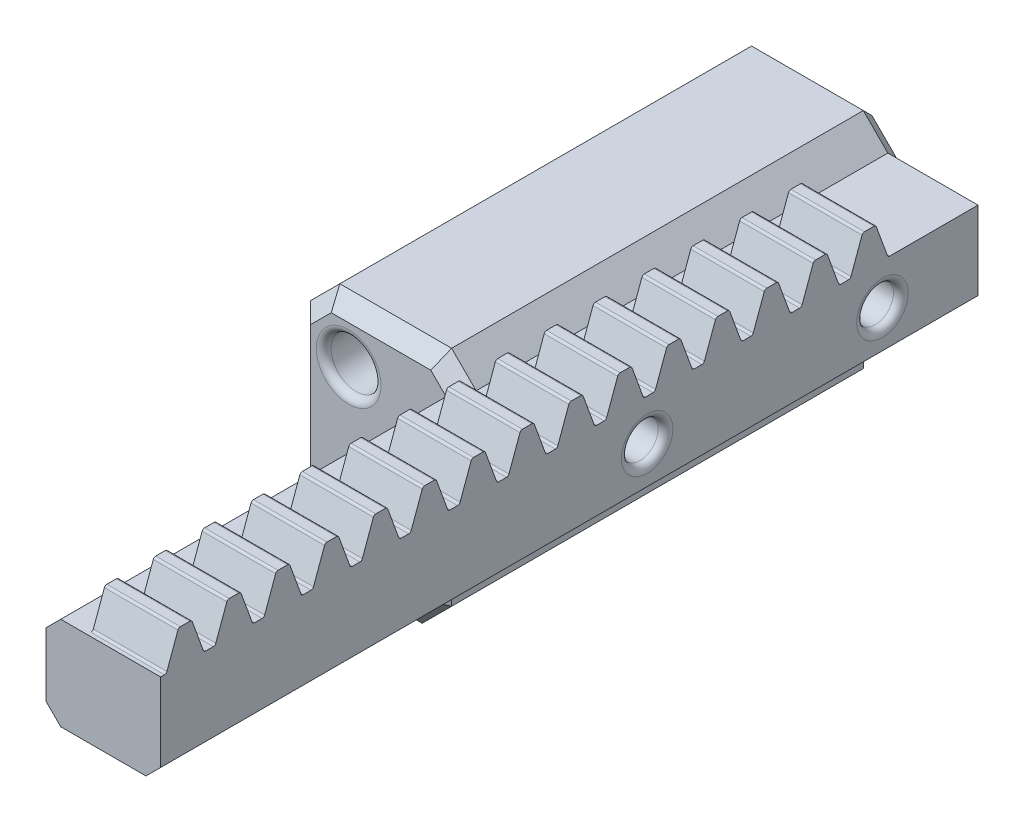
from build123d import *

# Parameters (mm, degrees)
ESBO_O2_W                     = 9.6
ESBO_O2_H                     = 17.2
ESBO_O2_R                     = 1.7
RESSALTO_EXTRUS_O2_DEPTH      = 30
CHANFRO1_SIZE                 = 2
RESSALTO_EXTRUS_O3_DEPTH      = 1
RESSALTO_EXTRUS_O3_DEPTH_BACK = 4
ESBO_O6_W                     = 30
ESBO_O6_H                     = 6.331
RESSALTO_EXTRUS_O5_DEPTH      = 2.8
CHANFRO3_SIZE                 = 1.67
FILETE1_R                     = 0.5
ESBO_O10_W                    = 10.953705829
ESBO_O10_H                    = 11.974910237
CORTE_EXTRUS_O3_DEPTH         = 5
CHANFRO6_SIZE2                = 4.5033321
CHANFRO6_SIZE                 = 7.8
ESBO_O11_W                    = 7.8
ESBO_O11_H                    = 4.5033321
CORTE_EXTRUS_O4_DEPTH         = 54
ESBO_O14_W                    = 18.817986942
ESBO_O14_H                    = 12.34246233
CORTE_EXTRUS_O5_DEPTH         = 7
ESBO_O15_W                    = 26.5845
ESBO_O15_H                    = 6.331
RESSALTO_EXTRUS_O7_DEPTH      = 2.799
CHANFRO11_SIZE                = 1
ESBO_O17_W                    = 7.697908569
ESBO_O17_H                    = 3.423278378
CORTE_EXTRUS_O7_DEPTH         = 5.5
CHANFRO12_SIZE                = 1
ESBO_O18_R                    = 1.25
CORTE_EXTRUS_O8_DEPTH         = 8.5
FILETE2_R                     = 0.5
CORTE_EXTRUS_O9_DEPTH         = 61.5


# Some blends are built 0.0001 mm under size
with BuildPart() as part:
    # Esboço2 → Ressalto-extrusão2 (new body)
    with BuildSketch(Plane.XY):
        with Locations((0.2, 0)):
            Rectangle(ESBO_O2_W, ESBO_O2_H)
        with Locations((-1, 5)):
            Circle(ESBO_O2_R, mode=Mode.SUBTRACT)
        with Locations((-1, -5)):
            Circle(ESBO_O2_R, mode=Mode.SUBTRACT)
    extrude(amount=RESSALTO_EXTRUS_O2_DEPTH)

    # Chanfro1
    chanfro1_edges = [part.edges().sort_by_distance(p)[0] for p in [
        (5, -8.6, 15),
        (-4.6, -8.6, 15),
        (-4.6, 8.6, 15),
    ]]
    chamfer(chanfro1_edges, length=CHANFRO1_SIZE)



with BuildPart() as body_2:
    # Esboço5 → Ressalto-extrusão3 (new, two sides: drawn at the far end of the back side and taken through both)
    with BuildSketch(Plane(origin=(11.8, 0, 0), x_dir=(0, 0, -1), z_dir=(1, 0, 0)).offset(-RESSALTO_EXTRUS_O3_DEPTH_BACK)):
        with BuildLine():
            Line((-4.590431133, 9.107195545), (-3.840510106, 7.046804455))
            ThreePointArc((-3.840510106, 7.046804455), (-3.776073657, 6.96282924), (-3.675124204, 6.931))
            Line((-3.675124204, 6.931), (-3.157875796, 6.931))
            ThreePointArc((-3.157875796, 6.931), (-3.056926343, 6.96282924), (-2.992489895, 7.046804455))
            Line((-2.992489895, 7.046804455), (-2.242568867, 9.107195545))
            ThreePointArc((-2.242568867, 9.107195545), (-2.178132418, 9.19117076), (-2.077182966, 9.223))
            Line((-2.077182966, 9.223), (-1.432817035, 9.223))
            ThreePointArc((-1.432817035, 9.223), (-1.331867582, 9.19117076), (-1.267431133, 9.107195545))
            Line((-1.267431133, 9.107195545), (-0.517510106, 7.046804455))
            ThreePointArc((-0.517510106, 7.046804455), (-0.453073657, 6.96282924), (-0.352124204, 6.931))
            Line((-0.352124204, 6.931), (0, 6.931))
            Line((0, 6.931), (0, 0.6))
            Line((0, 0.6), (-83.409875796, 0.6))
            Line((-83.409875796, 0.6), (-83.409875796, 6.931))
            Line((-83.409875796, 6.931), (-82.909875796, 6.931))
            ThreePointArc((-82.909875796, 6.931), (-82.808926343, 6.96282924), (-82.744489894, 7.046804455))
            Line((-82.744489894, 7.046804455), (-81.994568867, 9.107195545))
            ThreePointArc((-81.994568867, 9.107195545), (-81.930132418, 9.19117076), (-81.829182965, 9.223))
            Line((-81.829182965, 9.223), (-81.184817035, 9.223))
            ThreePointArc((-81.184817035, 9.223), (-81.083867582, 9.19117076), (-81.019431133, 9.107195545))
            Line((-81.019431133, 9.107195545), (-80.269510105, 7.046804455))
            ThreePointArc((-80.269510105, 7.046804455), (-80.205073657, 6.96282924), (-80.104124204, 6.931))
            Line((-80.104124204, 6.931), (-79.586875796, 6.931))
            ThreePointArc((-79.586875796, 6.931), (-79.485926343, 6.96282924), (-79.421489894, 7.046804455))
            Line((-79.421489894, 7.046804455), (-78.671568867, 9.107195545))
            ThreePointArc((-78.671568867, 9.107195545), (-78.607132418, 9.19117076), (-78.506182965, 9.223))
            Line((-78.506182965, 9.223), (-77.861817035, 9.223))
            ThreePointArc((-77.861817035, 9.223), (-77.760867582, 9.19117076), (-77.696431133, 9.107195545))
            Line((-77.696431133, 9.107195545), (-76.946510105, 7.046804455))
            ThreePointArc((-76.946510105, 7.046804455), (-76.882073657, 6.96282924), (-76.781124204, 6.931))
            Line((-76.781124204, 6.931), (-76.263875796, 6.931))
            ThreePointArc((-76.263875796, 6.931), (-76.162926343, 6.96282924), (-76.098489894, 7.046804455))
            Line((-76.098489894, 7.046804455), (-75.348568867, 9.107195545))
            ThreePointArc((-75.348568867, 9.107195545), (-75.284132418, 9.19117076), (-75.183182965, 9.223))
            Line((-75.183182965, 9.223), (-74.538817035, 9.223))
            ThreePointArc((-74.538817035, 9.223), (-74.437867582, 9.19117076), (-74.373431133, 9.107195545))
            Line((-74.373431133, 9.107195545), (-73.623510105, 7.046804455))
            ThreePointArc((-73.623510105, 7.046804455), (-73.559073657, 6.96282924), (-73.458124204, 6.931))
            Line((-73.458124204, 6.931), (-72.940875796, 6.931))
            ThreePointArc((-72.940875796, 6.931), (-72.839926343, 6.96282924), (-72.775489894, 7.046804455))
            Line((-72.775489894, 7.046804455), (-72.025568867, 9.107195545))
            ThreePointArc((-72.025568867, 9.107195545), (-71.961132418, 9.19117076), (-71.860182965, 9.223))
            Line((-71.860182965, 9.223), (-71.215817035, 9.223))
            ThreePointArc((-71.215817035, 9.223), (-71.114867582, 9.19117076), (-71.050431133, 9.107195545))
            Line((-71.050431133, 9.107195545), (-70.300510105, 7.046804455))
            ThreePointArc((-70.300510105, 7.046804455), (-70.236073657, 6.96282924), (-70.135124204, 6.931))
            Line((-70.135124204, 6.931), (-69.617875796, 6.931))
            ThreePointArc((-69.617875796, 6.931), (-69.516926343, 6.96282924), (-69.452489894, 7.046804455))
            Line((-69.452489894, 7.046804455), (-68.702568867, 9.107195545))
            ThreePointArc((-68.702568867, 9.107195545), (-68.638132418, 9.19117076), (-68.537182965, 9.223))
            Line((-68.537182965, 9.223), (-67.892817035, 9.223))
            ThreePointArc((-67.892817035, 9.223), (-67.791867582, 9.19117076), (-67.727431133, 9.107195545))
            Line((-67.727431133, 9.107195545), (-66.977510105, 7.046804455))
            ThreePointArc((-66.977510105, 7.046804455), (-66.913073657, 6.96282924), (-66.812124204, 6.931))
            Line((-66.812124204, 6.931), (-66.294875796, 6.931))
            ThreePointArc((-66.294875796, 6.931), (-66.193926343, 6.96282924), (-66.129489894, 7.046804455))
            Line((-66.129489894, 7.046804455), (-65.379568867, 9.107195545))
            ThreePointArc((-65.379568867, 9.107195545), (-65.315132418, 9.19117076), (-65.214182965, 9.223))
            Line((-65.214182965, 9.223), (-64.569817035, 9.223))
            ThreePointArc((-64.569817035, 9.223), (-64.468867582, 9.19117076), (-64.404431133, 9.107195545))
            Line((-64.404431133, 9.107195545), (-63.654510105, 7.046804455))
            ThreePointArc((-63.654510105, 7.046804455), (-63.590073657, 6.96282924), (-63.489124204, 6.931))
            Line((-63.489124204, 6.931), (-62.971875796, 6.931))
            ThreePointArc((-62.971875796, 6.931), (-62.870926343, 6.96282924), (-62.806489894, 7.046804455))
            Line((-62.806489894, 7.046804455), (-62.056568867, 9.107195545))
            ThreePointArc((-62.056568867, 9.107195545), (-61.992132418, 9.19117076), (-61.891182965, 9.223))
            Line((-61.891182965, 9.223), (-61.246817035, 9.223))
            ThreePointArc((-61.246817035, 9.223), (-61.145867582, 9.19117076), (-61.081431133, 9.107195545))
            Line((-61.081431133, 9.107195545), (-60.331510105, 7.046804455))
            ThreePointArc((-60.331510105, 7.046804455), (-60.267073657, 6.96282924), (-60.166124204, 6.931))
            Line((-60.166124204, 6.931), (-59.648875796, 6.931))
            ThreePointArc((-59.648875796, 6.931), (-59.547926343, 6.96282924), (-59.483489895, 7.046804455))
            Line((-59.483489895, 7.046804455), (-58.733568867, 9.107195545))
            ThreePointArc((-58.733568867, 9.107195545), (-58.669132418, 9.19117076), (-58.568182965, 9.223))
            Line((-58.568182965, 9.223), (-57.923817035, 9.223))
            ThreePointArc((-57.923817035, 9.223), (-57.822867582, 9.19117076), (-57.758431133, 9.107195545))
            Line((-57.758431133, 9.107195545), (-57.008510105, 7.046804455))
            ThreePointArc((-57.008510105, 7.046804455), (-56.944073657, 6.96282924), (-56.843124204, 6.931))
            Line((-56.843124204, 6.931), (-56.325875796, 6.931))
            ThreePointArc((-56.325875796, 6.931), (-56.224926343, 6.96282924), (-56.160489895, 7.046804455))
            Line((-56.160489895, 7.046804455), (-55.410568867, 9.107195545))
            ThreePointArc((-55.410568867, 9.107195545), (-55.346132418, 9.19117076), (-55.245182965, 9.223))
            Line((-55.245182965, 9.223), (-54.600817035, 9.223))
            ThreePointArc((-54.600817035, 9.223), (-54.499867582, 9.19117076), (-54.435431133, 9.107195545))
            Line((-54.435431133, 9.107195545), (-53.685510105, 7.046804455))
            ThreePointArc((-53.685510105, 7.046804455), (-53.621073657, 6.96282924), (-53.520124204, 6.931))
            Line((-53.520124204, 6.931), (-53.002875796, 6.931))
            ThreePointArc((-53.002875796, 6.931), (-52.901926343, 6.96282924), (-52.837489895, 7.046804455))
            Line((-52.837489895, 7.046804455), (-52.087568867, 9.107195545))
            ThreePointArc((-52.087568867, 9.107195545), (-52.023132418, 9.19117076), (-51.922182965, 9.223))
            Line((-51.922182965, 9.223), (-51.277817035, 9.223))
            ThreePointArc((-51.277817035, 9.223), (-51.176867582, 9.19117076), (-51.112431133, 9.107195545))
            Line((-51.112431133, 9.107195545), (-50.362510105, 7.046804455))
            ThreePointArc((-50.362510105, 7.046804455), (-50.298073657, 6.96282924), (-50.197124204, 6.931))
            Line((-50.197124204, 6.931), (-49.679875796, 6.931))
            ThreePointArc((-49.679875796, 6.931), (-49.578926343, 6.96282924), (-49.514489895, 7.046804455))
            Line((-49.514489895, 7.046804455), (-48.764568867, 9.107195545))
            ThreePointArc((-48.764568867, 9.107195545), (-48.700132418, 9.19117076), (-48.599182965, 9.223))
            Line((-48.599182965, 9.223), (-47.954817035, 9.223))
            ThreePointArc((-47.954817035, 9.223), (-47.853867582, 9.19117076), (-47.789431133, 9.107195545))
            Line((-47.789431133, 9.107195545), (-47.039510105, 7.046804455))
            ThreePointArc((-47.039510105, 7.046804455), (-46.975073657, 6.96282924), (-46.874124204, 6.931))
            Line((-46.874124204, 6.931), (-46.356875796, 6.931))
            ThreePointArc((-46.356875796, 6.931), (-46.255926343, 6.96282924), (-46.191489895, 7.046804455))
            Line((-46.191489895, 7.046804455), (-45.441568867, 9.107195545))
            ThreePointArc((-45.441568867, 9.107195545), (-45.377132418, 9.19117076), (-45.276182965, 9.223))
            Line((-45.276182965, 9.223), (-44.631817035, 9.223))
            ThreePointArc((-44.631817035, 9.223), (-44.530867582, 9.19117076), (-44.466431133, 9.107195545))
            Line((-44.466431133, 9.107195545), (-43.716510105, 7.046804455))
            ThreePointArc((-43.716510105, 7.046804455), (-43.652073657, 6.96282924), (-43.551124204, 6.931))
            Line((-43.551124204, 6.931), (-43.033875796, 6.931))
            ThreePointArc((-43.033875796, 6.931), (-42.932926343, 6.96282924), (-42.868489895, 7.046804455))
            Line((-42.868489895, 7.046804455), (-42.118568867, 9.107195545))
            ThreePointArc((-42.118568867, 9.107195545), (-42.054132418, 9.19117076), (-41.953182965, 9.223))
            Line((-41.953182965, 9.223), (-41.308817035, 9.223))
            ThreePointArc((-41.308817035, 9.223), (-41.207867582, 9.19117076), (-41.143431133, 9.107195545))
            Line((-41.143431133, 9.107195545), (-40.393510105, 7.046804455))
            ThreePointArc((-40.393510105, 7.046804455), (-40.329073657, 6.96282924), (-40.228124204, 6.931))
            Line((-40.228124204, 6.931), (-39.710875796, 6.931))
            ThreePointArc((-39.710875796, 6.931), (-39.609926343, 6.96282924), (-39.545489895, 7.046804455))
            Line((-39.545489895, 7.046804455), (-38.795568867, 9.107195545))
            ThreePointArc((-38.795568867, 9.107195545), (-38.731132418, 9.19117076), (-38.630182965, 9.223))
            Line((-38.630182965, 9.223), (-37.985817035, 9.223))
            ThreePointArc((-37.985817035, 9.223), (-37.884867582, 9.19117076), (-37.820431133, 9.107195545))
            Line((-37.820431133, 9.107195545), (-37.070510105, 7.046804455))
            ThreePointArc((-37.070510105, 7.046804455), (-37.006073657, 6.96282924), (-36.905124204, 6.931))
            Line((-36.905124204, 6.931), (-36.387875796, 6.931))
            ThreePointArc((-36.387875796, 6.931), (-36.286926343, 6.96282924), (-36.222489895, 7.046804455))
            Line((-36.222489895, 7.046804455), (-35.472568867, 9.107195545))
            ThreePointArc((-35.472568867, 9.107195545), (-35.408132418, 9.19117076), (-35.307182965, 9.223))
            Line((-35.307182965, 9.223), (-34.662817035, 9.223))
            ThreePointArc((-34.662817035, 9.223), (-34.561867582, 9.19117076), (-34.497431133, 9.107195545))
            Line((-34.497431133, 9.107195545), (-33.747510105, 7.046804455))
            ThreePointArc((-33.747510105, 7.046804455), (-33.683073657, 6.96282924), (-33.582124204, 6.931))
            Line((-33.582124204, 6.931), (-33.064875796, 6.931))
            ThreePointArc((-33.064875796, 6.931), (-32.963926343, 6.96282924), (-32.899489895, 7.046804455))
            Line((-32.899489895, 7.046804455), (-32.149568867, 9.107195545))
            ThreePointArc((-32.149568867, 9.107195545), (-32.085132418, 9.19117076), (-31.984182965, 9.223))
            Line((-31.984182965, 9.223), (-31.339817035, 9.223))
            ThreePointArc((-31.339817035, 9.223), (-31.238867582, 9.19117076), (-31.174431133, 9.107195545))
            Line((-31.174431133, 9.107195545), (-30.424510106, 7.046804455))
            ThreePointArc((-30.424510106, 7.046804455), (-30.360073657, 6.96282924), (-30.259124204, 6.931))
            Line((-30.259124204, 6.931), (-29.741875796, 6.931))
            ThreePointArc((-29.741875796, 6.931), (-29.640926343, 6.96282924), (-29.576489895, 7.046804455))
            Line((-29.576489895, 7.046804455), (-28.826568867, 9.107195545))
            ThreePointArc((-28.826568867, 9.107195545), (-28.762132418, 9.19117076), (-28.661182965, 9.223))
            Line((-28.661182965, 9.223), (-28.016817035, 9.223))
            ThreePointArc((-28.016817035, 9.223), (-27.915867582, 9.19117076), (-27.851431133, 9.107195545))
            Line((-27.851431133, 9.107195545), (-27.101510106, 7.046804455))
            ThreePointArc((-27.101510106, 7.046804455), (-27.037073657, 6.96282924), (-26.936124204, 6.931))
            Line((-26.936124204, 6.931), (-26.418875796, 6.931))
            ThreePointArc((-26.418875796, 6.931), (-26.317926343, 6.96282924), (-26.253489895, 7.046804455))
            Line((-26.253489895, 7.046804455), (-25.503568867, 9.107195545))
            ThreePointArc((-25.503568867, 9.107195545), (-25.439132418, 9.19117076), (-25.338182965, 9.223))
            Line((-25.338182965, 9.223), (-24.693817035, 9.223))
            ThreePointArc((-24.693817035, 9.223), (-24.592867582, 9.19117076), (-24.528431133, 9.107195545))
            Line((-24.528431133, 9.107195545), (-23.778510106, 7.046804455))
            ThreePointArc((-23.778510106, 7.046804455), (-23.714073657, 6.96282924), (-23.613124204, 6.931))
            Line((-23.613124204, 6.931), (-23.095875796, 6.931))
            ThreePointArc((-23.095875796, 6.931), (-22.994926343, 6.96282924), (-22.930489895, 7.046804455))
            Line((-22.930489895, 7.046804455), (-22.180568867, 9.107195545))
            ThreePointArc((-22.180568867, 9.107195545), (-22.116132418, 9.19117076), (-22.015182965, 9.223))
            Line((-22.015182965, 9.223), (-21.370817035, 9.223))
            ThreePointArc((-21.370817035, 9.223), (-21.269867582, 9.19117076), (-21.205431133, 9.107195545))
            Line((-21.205431133, 9.107195545), (-20.455510106, 7.046804455))
            ThreePointArc((-20.455510106, 7.046804455), (-20.391073657, 6.96282924), (-20.290124204, 6.931))
            Line((-20.290124204, 6.931), (-19.772875796, 6.931))
            ThreePointArc((-19.772875796, 6.931), (-19.671926343, 6.96282924), (-19.607489895, 7.046804455))
            Line((-19.607489895, 7.046804455), (-18.857568867, 9.107195545))
            ThreePointArc((-18.857568867, 9.107195545), (-18.793132418, 9.19117076), (-18.692182965, 9.223))
            Line((-18.692182965, 9.223), (-18.047817035, 9.223))
            ThreePointArc((-18.047817035, 9.223), (-17.946867582, 9.19117076), (-17.882431133, 9.107195545))
            Line((-17.882431133, 9.107195545), (-17.132510106, 7.046804455))
            ThreePointArc((-17.132510106, 7.046804455), (-17.068073657, 6.96282924), (-16.967124204, 6.931))
            Line((-16.967124204, 6.931), (-16.449875796, 6.931))
            ThreePointArc((-16.449875796, 6.931), (-16.348926343, 6.96282924), (-16.284489895, 7.046804455))
            Line((-16.284489895, 7.046804455), (-15.534568867, 9.107195545))
            ThreePointArc((-15.534568867, 9.107195545), (-15.470132418, 9.19117076), (-15.369182966, 9.223))
            Line((-15.369182966, 9.223), (-14.724817035, 9.223))
            ThreePointArc((-14.724817035, 9.223), (-14.623867582, 9.19117076), (-14.559431133, 9.107195545))
            Line((-14.559431133, 9.107195545), (-13.809510106, 7.046804455))
            ThreePointArc((-13.809510106, 7.046804455), (-13.745073657, 6.96282924), (-13.644124204, 6.931))
            Line((-13.644124204, 6.931), (-13.126875796, 6.931))
            ThreePointArc((-13.126875796, 6.931), (-13.025926343, 6.96282924), (-12.961489895, 7.046804455))
            Line((-12.961489895, 7.046804455), (-12.211568867, 9.107195545))
            ThreePointArc((-12.211568867, 9.107195545), (-12.147132418, 9.19117076), (-12.046182966, 9.223))
            Line((-12.046182966, 9.223), (-11.401817035, 9.223))
            ThreePointArc((-11.401817035, 9.223), (-11.300867582, 9.19117076), (-11.236431133, 9.107195545))
            Line((-11.236431133, 9.107195545), (-10.486510106, 7.046804455))
            ThreePointArc((-10.486510106, 7.046804455), (-10.422073657, 6.96282924), (-10.321124204, 6.931))
            Line((-10.321124204, 6.931), (-9.803875796, 6.931))
            ThreePointArc((-9.803875796, 6.931), (-9.702926343, 6.96282924), (-9.638489895, 7.046804455))
            Line((-9.638489895, 7.046804455), (-8.888568867, 9.107195545))
            ThreePointArc((-8.888568867, 9.107195545), (-8.824132418, 9.19117076), (-8.723182966, 9.223))
            Line((-8.723182966, 9.223), (-8.078817035, 9.223))
            ThreePointArc((-8.078817035, 9.223), (-7.977867582, 9.19117076), (-7.913431133, 9.107195545))
            Line((-7.913431133, 9.107195545), (-7.163510106, 7.046804455))
            ThreePointArc((-7.163510106, 7.046804455), (-7.099073657, 6.96282924), (-6.998124204, 6.931))
            Line((-6.998124204, 6.931), (-6.480875796, 6.931))
            ThreePointArc((-6.480875796, 6.931), (-6.379926343, 6.96282924), (-6.315489895, 7.046804455))
            Line((-6.315489895, 7.046804455), (-5.565568867, 9.107195545))
            ThreePointArc((-5.565568867, 9.107195545), (-5.501132418, 9.19117076), (-5.400182966, 9.223))
            Line((-5.400182966, 9.223), (-4.755817035, 9.223))
            ThreePointArc((-4.755817035, 9.223), (-4.654867582, 9.19117076), (-4.590431133, 9.107195545))
        make_face()
    extrude(amount=RESSALTO_EXTRUS_O3_DEPTH + RESSALTO_EXTRUS_O3_DEPTH_BACK)


with BuildPart() as part_1:
    add(part.part)

    add(body_2.part)  # Ressalto-extrusão5 merges body 2
    # Esboço6 → Ressalto-extrusão5 (add)
    with BuildSketch(Plane.ZY.offset(-7.8)):
        with Locations((15, 3.7655)):
            Rectangle(ESBO_O6_W, ESBO_O6_H)
    extrude(amount=RESSALTO_EXTRUS_O5_DEPTH)

    # Chanfro3
    # the kernel refuses this chamfer: 1.67 mm, written as the material it adds along each edge
    with BuildSketch(Plane(origin=(5, 6.931, 0), x_dir=(0, 1, 0), z_dir=(0, 0, 1))) as chanfro3_piece_1_section:
        Polygon((CHANFRO3_SIZE, 0), (0, -CHANFRO3_SIZE), (0, 0), align=None)
    chanfro3_piece_1 = extrude(amount=30, mode=Mode.PRIVATE)
    chanfro3_piece_1 = split(chanfro3_piece_1, bisect_by=Plane(origin=(5, 8.6, 0), z_dir=(0, -1, 0)), keep=Keep.TOP, mode=Mode.PRIVATE)
    add(chanfro3_piece_1)

    # Filete1
    filete1_edges = [part_1.edges().sort_by_distance(p)[0] for p in [
        (-2.7, 5, 0),
        (-2.7, -5, 0),
        (-2.7, 5, 30),
        (-2.7, -5, 30),
    ]]
    fillet(filete1_edges, radius=FILETE1_R)

    # Esboço10 → Corte-extrusão3 (cut)
    with BuildSketch(Plane(origin=(12.8, 0, 0), x_dir=(0, 0, -1), z_dir=(1, 0, 0))):
        with Locations((-78.676352915, 4.476477999)):
            Rectangle(ESBO_O10_W, ESBO_O10_H)
    extrude(amount=-CORTE_EXTRUS_O3_DEPTH, mode=Mode.SUBTRACT)

    # Chanfro6
    chanfro6_edges = [part_1.edges().sort_by_distance(p)[0] for p in [
        (5, 0.6, 15),
    ]]
    chanfro6_side = [part_1.faces().sort_by_distance(p)[0] for p in [
        (5.090066642, 0.6, 15),
    ]]
    chamfer(chanfro6_edges, length=CHANFRO6_SIZE - 0.0001, length2=CHANFRO6_SIZE2 - 0.0001, reference=chanfro6_side[0])  # a hair under: the kernel refuses the full size

    # Esboço11 → Corte-extrusão4 (cut)
    with BuildSketch(Plane.XY.offset(30)):
        with Locations((8.9, -1.65166605)):
            Rectangle(ESBO_O11_W, ESBO_O11_H)
    extrude(amount=CORTE_EXTRUS_O4_DEPTH, mode=Mode.SUBTRACT)

    # Esboço14 → Corte-extrusão5 (cut)
    with BuildSketch(Plane(origin=(12.8, 0, 0), x_dir=(0, 0, -1), z_dir=(1, 0, 0))):
        with Locations((-65.993493471, 3.954912046)):
            Rectangle(ESBO_O14_W, ESBO_O14_H)
    extrude(amount=-CORTE_EXTRUS_O5_DEPTH, mode=Mode.SUBTRACT)

    # Esboço15 → Ressalto-extrusão7 (add)
    with BuildSketch(Plane.ZY.offset(-7.8)):
        with Locations((43.29225, 3.7655)):
            Rectangle(ESBO_O15_W, ESBO_O15_H)
    extrude(amount=RESSALTO_EXTRUS_O7_DEPTH)

    # Chanfro11
    chanfro11_edges = [part_1.edges().sort_by_distance(p)[0] for p in [
        (5.001, 6.931, 43.29225),
        (5.001, 0.6, 43.29225),
    ]]
    chamfer(chanfro11_edges, length=CHANFRO11_SIZE)

    # Esboço17 → Corte-extrusão7 (cut)
    with BuildSketch(Plane(origin=(12.8, 0, 0), x_dir=(0, 0, -1), z_dir=(1, 0, 0))):
        with Locations((-3.14916992, 8.642639189)):
            Rectangle(ESBO_O17_W, ESBO_O17_H)
    extrude(amount=-CORTE_EXTRUS_O7_DEPTH, mode=Mode.SUBTRACT)

    # Chanfro12
    # the kernel refuses this chamfer: 1 mm, written as the material it takes off along each edge
    with BuildSketch(Plane(origin=(-0.78154552, 10.41845448, 30), x_dir=(0.7071067811865476, -0.7071067811865476, 3.5527136788004994e-15), z_dir=(-0.7071067811865476, -0.7071067811865476, 0)), Plane(origin=(-0.78154552, -10.41845448, 0), x_dir=(0.7071067811865476, 0.7071067811865476, 0), z_dir=(-0.7071067811865476, 0.7071067811865476, 0)), Plane(origin=(6.81845448, -4.78154552, 0), x_dir=(-0.7071067811865476, 0.7071067811865476, 0), z_dir=(-0.7071067811865476, -0.7071067811865476, 0))) as chanfro12_piece_1:
        Polygon((CHANFRO12_SIZE, 0), (0, -CHANFRO12_SIZE), (0, 0), align=None)
    extrude(amount=7.971793101, mode=Mode.SUBTRACT)
    with BuildSketch(Plane(origin=(-0.78154552, 10.41845448, 0), x_dir=(0.7071067811865476, -0.7071067811865476, 0), z_dir=(-0.7071067811865476, -0.7071067811865476, 0)), Plane(origin=(-0.78154552, -10.41845448, 30), x_dir=(0.7071067811865476, 0.7071067811865476, 3.5527136788004994e-15), z_dir=(-0.7071067811865476, 0.7071067811865476, 0)), Plane(origin=(6.81845448, -4.78154552, 30), x_dir=(-0.7071067811865476, 0.7071067811865476, 3.5527136788004994e-15), z_dir=(-0.7071067811865476, -0.7071067811865476, 0))) as chanfro12_piece_2:
        Polygon((CHANFRO12_SIZE, 0), (0, CHANFRO12_SIZE), (0, 0), align=None)
    extrude(amount=7.971793101, mode=Mode.SUBTRACT)
    with BuildSketch(Plane(origin=(-4.6, -9.171682988, 30), x_dir=(1, 0, 0), z_dir=(0, 1, 0))) as chanfro12_piece_3:
        Polygon((CHANFRO12_SIZE, 0), (0, CHANFRO12_SIZE), (0, 0), align=None)
    extrude(amount=18.343365976, mode=Mode.SUBTRACT)
    with BuildSketch(Plane(origin=(-4.6, -9.171682988, 0), x_dir=(1, 0, 0), z_dir=(0, 1, 0))) as chanfro12_piece_4:
        Polygon((CHANFRO12_SIZE, 0), (0, -CHANFRO12_SIZE), (0, 0), align=None)
    extrude(amount=18.343365976, mode=Mode.SUBTRACT)
    with BuildSketch(Plane(origin=(5.571682988, -8.6, 0), x_dir=(0, 1, 0), z_dir=(-1, 0, 0))) as chanfro12_piece_5:
        Polygon((CHANFRO12_SIZE, 0), (0, -CHANFRO12_SIZE), (0, 0), align=None)
    extrude(amount=10.743365976, mode=Mode.SUBTRACT)
    with BuildSketch(Plane(origin=(5.571682988, -8.6, 30), x_dir=(0, 1, 0), z_dir=(-1, 0, 0))) as chanfro12_piece_6:
        Polygon((CHANFRO12_SIZE, 0), (0, CHANFRO12_SIZE), (0, 0), align=None)
    extrude(amount=10.743365976, mode=Mode.SUBTRACT)
    with BuildSketch(Plane(origin=(5, -1.331549112, 0), x_dir=(-1, 0, 0), z_dir=(0, -1, 0))) as chanfro12_piece_7_section:
        Polygon((CHANFRO12_SIZE, 0), (0, -CHANFRO12_SIZE), (0, 0), align=None)
    chanfro12_piece_7 = extrude(amount=7.840133876, mode=Mode.PRIVATE)
    chanfro12_piece_7 = split(chanfro12_piece_7, bisect_by=Plane(origin=(5.306784846, -1.86292104, -0.613574012), z_dir=(0.35355090192684113, -0.6123738725212867, -0.7071067811865478)), keep=Keep.TOP, mode=Mode.PRIVATE)
    add(chanfro12_piece_7, mode=Mode.SUBTRACT)
    with BuildSketch(Plane(origin=(5, -1.331549112, 30), x_dir=(-1, 0, 0), z_dir=(0, -1, 0))) as chanfro12_piece_8_section:
        Polygon((CHANFRO12_SIZE, 0), (0, CHANFRO12_SIZE), (0, 0), align=None)
    chanfro12_piece_8 = extrude(amount=7.840133876, mode=Mode.PRIVATE)
    chanfro12_piece_8 = split(chanfro12_piece_8, bisect_by=Plane(origin=(5.306784865, -1.862921066, 30.61357403), z_dir=(0.3535509086765775, -0.6123738774348315, 0.7071067735564385)), keep=Keep.TOP, mode=Mode.PRIVATE)
    add(chanfro12_piece_8, mode=Mode.SUBTRACT)
    with BuildSketch(Plane(origin=(2.772851983, -5.189064603, 30), x_dir=(-0.49999648464448365, 0.8660274333663793, 0), z_dir=(0.8660274333663794, 0.4999964846444837, 0))) as chanfro12_piece_9_section:
        Polygon((CHANFRO12_SIZE, 0), (CHANFRO12_SIZE * 2.15812068548e-08, -CHANFRO12_SIZE), (0, 0), align=None)
    chanfro12_piece_9 = extrude(amount=14.149893596, mode=Mode.PRIVATE)
    chanfro12_piece_9 = split(chanfro12_piece_9, bisect_by=Plane(origin=(2.772851983, 0.6, 30), z_dir=(0, -1, 0)), keep=Keep.TOP, mode=Mode.PRIVATE)
    chanfro12_piece_9 = split(chanfro12_piece_9, bisect_by=Plane(origin=(3.386425992, -5.189064603, 30.613574008), z_dir=(0.7071067811865476, 0, 0.7071067811865476)), keep=Keep.TOP, mode=Mode.PRIVATE)
    add(chanfro12_piece_9, mode=Mode.SUBTRACT)
    with BuildSketch(Plane(origin=(15.027048024, 1.885832443, 0), x_dir=(-0.49999648049417866, 0.8660274357625367, 0), z_dir=(-0.8660274357625366, -0.49999648049417866, 0))) as chanfro12_piece_10_section:
        Polygon((CHANFRO12_SIZE, 0), (0, -CHANFRO12_SIZE), (0, 0), align=None)
    chanfro12_piece_10 = extrude(amount=14.149893573, mode=Mode.PRIVATE)
    chanfro12_piece_10 = split(chanfro12_piece_10, bisect_by=Plane(origin=(9.513524012, 1.885832443, 5.513524012), z_dir=(0.7071067811865476, 0, -0.7071067811865476)), keep=Keep.TOP, mode=Mode.PRIVATE)
    add(chanfro12_piece_10, mode=Mode.SUBTRACT)
    with BuildSketch(Plane(origin=(12.8, 9.502682988, 0), x_dir=(-1.0, 0, 8.872288167750264e-12), z_dir=(0, -1, 0))) as chanfro12_piece_11:
        Polygon((CHANFRO12_SIZE, 0), (0, -CHANFRO12_SIZE), (0, 0), align=None)
    extrude(amount=11.474365976, mode=Mode.SUBTRACT)
    with BuildSketch(Plane(origin=(15.371682988, 6.931, 0), x_dir=(0, -1.0, 8.873748753935874e-12), z_dir=(-1, 0, 0))) as chanfro12_piece_12:
        Polygon((CHANFRO12_SIZE, 0), (0, CHANFRO12_SIZE), (0, 0), align=None)
    extrude(amount=7.571682988, mode=Mode.SUBTRACT)
    with BuildSketch(Plane(origin=(3.18254552, 10.41845448, 30), x_dir=(-0.7071067811865476, -0.7071067811865476, 0), z_dir=(0.7071067811865476, -0.7071067811865476, 0))) as chanfro12_piece_13_section:
        Polygon((CHANFRO12_SIZE, 0), (0, CHANFRO12_SIZE), (0, 0), align=None)
    chanfro12_piece_13 = extrude(amount=7.503688412, mode=Mode.PRIVATE)
    chanfro12_piece_13 = split(chanfro12_piece_13, bisect_by=Plane(origin=(3.18254552, 6.931, 30), z_dir=(0, 1, 0)), keep=Keep.TOP, mode=Mode.PRIVATE)
    add(chanfro12_piece_13, mode=Mode.SUBTRACT)
    with BuildSketch(Plane(origin=(3.18254552, 10.41845448, 30), x_dir=(-0.7071067811865476, -0.7071067811865476, 0), z_dir=(0.7071067811865476, -0.7071067811865476, 0))) as chanfro12_piece_14_section:
        Polygon((CHANFRO12_SIZE, 0), (0, CHANFRO12_SIZE), (0, 0), align=None)
    chanfro12_piece_14 = extrude(amount=7.503688412, mode=Mode.PRIVATE)
    chanfro12_piece_14 = split(chanfro12_piece_14, bisect_by=Plane(origin=(6.3355, 7.2655, 30), z_dir=(-0.7071067811865476, 0.7071067811865476, 0)), keep=Keep.TOP, mode=Mode.PRIVATE)
    add(chanfro12_piece_14, mode=Mode.SUBTRACT)
    with BuildSketch(Plane(origin=(3.18254552, 10.41845448, 0), x_dir=(-0.7071067811865476, -0.7071067811865476, 0), z_dir=(0.7071067811865476, -0.7071067811865476, 0))) as chanfro12_piece_15_section:
        Polygon((CHANFRO12_SIZE, 0), (0, -CHANFRO12_SIZE), (0, 0), align=None)
    chanfro12_piece_15 = extrude(amount=7.503688412, mode=Mode.PRIVATE)
    chanfro12_piece_15 = split(chanfro12_piece_15, bisect_by=Plane(origin=(3.18254552, 8.17472724, 2.24372724), z_dir=(-2.6891523476325746e-12, 0.7071067811857663, -0.7071067811873288)), keep=Keep.TOP, mode=Mode.PRIVATE)
    add(chanfro12_piece_15, mode=Mode.SUBTRACT)
    with BuildSketch(Plane(origin=(-5.171682988, 8.6, 0), x_dir=(0, -1, 0), z_dir=(1, 0, 0)), Plane(origin=(7.572682988, 8.6, 30), x_dir=(0, -1, 0), z_dir=(-1, 0, 0))) as chanfro12_piece_16:
        Polygon((CHANFRO12_SIZE, 0), (0, -CHANFRO12_SIZE), (0, 0), align=None)
    extrude(amount=12.744365976, mode=Mode.SUBTRACT)
    with BuildSketch(Plane(origin=(7.8, 6.931, 0), x_dir=(-1.234017804274897e-13, -1.0, 2.218437188484453e-12), z_dir=(-1.0, 1.2340178043620026e-13, 3.926437501741161e-12))) as chanfro12_piece_17_section:
        Polygon((CHANFRO12_SIZE, 0), (0, CHANFRO12_SIZE), (0, 0), align=None)
    chanfro12_piece_17 = extrude(amount=3.701682988, mode=Mode.PRIVATE)
    chanfro12_piece_17 = split(chanfro12_piece_17, bisect_by=Plane(origin=(7.163946609, 6.294946609, 0.899515331), z_dir=(0.5, 0.49999999999999994, -0.7071067811865478)), keep=Keep.TOP, mode=Mode.PRIVATE)
    add(chanfro12_piece_17, mode=Mode.SUBTRACT)

    # Esboço18 → Corte-extrusão8 (cut)
    with BuildSketch(Plane(origin=(12.8, 0, 0), x_dir=(0, 0, -1), z_dir=(1, 0, 0))):
        with Locations(Location((-23.5, 4.131, 0), (0, 0, 90))):
            Circle(ESBO_O18_R)
        with Locations(Location((-7.5, 4.131, 0), (0, 0, 90))):
            Circle(ESBO_O18_R)
    extrude(amount=-CORTE_EXTRUS_O8_DEPTH, mode=Mode.SUBTRACT)

    # Filete2
    filete2_edges = [part_1.edges().sort_by_distance(p)[0] for p in [
        (12.8, 2.881, 23.5),
        (12.8, 2.881, 7.5),
    ]]
    fillet(filete2_edges, radius=FILETE2_R)

    # Esboço19 → Corte-extrusão9 (cut)
    with BuildSketch(Plane.XY.offset(56.5845)):
        Polygon((9.485976438, -1.714023562), (13.26721147, 2.06721147), (13.26721147, -2.522055339), (9.485976438, -2.522055339), align=None)
    extrude(amount=-CORTE_EXTRUS_O9_DEPTH, mode=Mode.SUBTRACT)


solid = part_1.part
